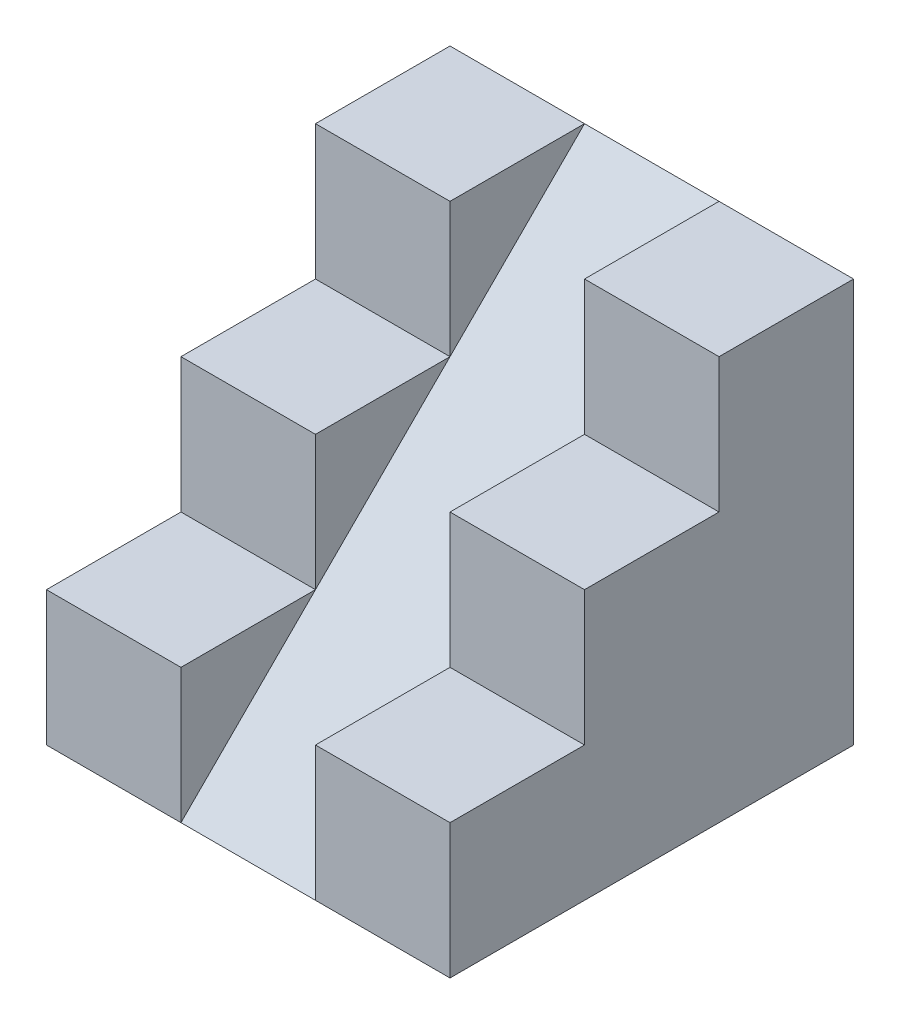
from build123d import *

# Parameters (mm, degrees)
CROQUIS1_W                = 20
CROQUIS1_H                = 60
SALIENTE_EXTRUIR1_DEPTH   = 20
SALIENTE_EXTRUIR1_2_DEPTH = 20
CROQUIS2_W                = 20
CROQUIS2_H                = 40
SALIENTE_EXTRUIR2_DEPTH   = 20
CROQUIS3_W                = 20
CROQUIS3_H                = 20
SALIENTE_EXTRUIR3_DEPTH   = 20
CROQUIS4_W                = 20
CROQUIS4_H                = 60
SALIENTE_EXTRUIR9_DEPTH   = 60
CHAFL_N1_SIZE             = 60


with BuildPart() as part:
    # Croquis1 → Saliente-Extruir1 (new body)
    with BuildSketch(Plane(origin=(0, 0, 0), x_dir=(1, 0, 0), z_dir=(0, 1, 0))):
        with Locations((20, 0)):
            Rectangle(CROQUIS1_W, CROQUIS1_H)
    extrude(amount=SALIENTE_EXTRUIR1_DEPTH)



with BuildPart() as body_2:
    # Croquis1 → Saliente-Extruir1 2 (new body)
    with BuildSketch(Plane(origin=(0, 0, 0), x_dir=(1, 0, 0), z_dir=(0, 1, 0))):
        with Locations((-20, 0)):
            Rectangle(CROQUIS1_W, CROQUIS1_H)
    extrude(amount=SALIENTE_EXTRUIR1_2_DEPTH)


with BuildPart() as part_1:
    add(part.part)

    add(body_2.part)  # Saliente-Extruir2 merges body 2
    # Croquis2 → Saliente-Extruir2 (add)
    with BuildSketch(Plane(origin=(0, 20, 0), x_dir=(1, 0, 0), z_dir=(0, 1, 0))):
        with Locations((20, 10)):
            Rectangle(CROQUIS2_W, CROQUIS2_H)
        with Locations((-20, 10)):
            Rectangle(CROQUIS2_W, CROQUIS2_H)
    extrude(amount=SALIENTE_EXTRUIR2_DEPTH)

    # Croquis3 → Saliente-Extruir3 (add)
    with BuildSketch(Plane(origin=(0, 40, 0), x_dir=(1, 0, 0), z_dir=(0, 1, 0))):
        with Locations((20, 20)):
            Rectangle(CROQUIS3_W, CROQUIS3_H)
        with Locations((-20, 20)):
            Rectangle(CROQUIS3_W, CROQUIS3_H)
    extrude(amount=SALIENTE_EXTRUIR3_DEPTH)


with BuildPart() as body_2_2:
    # Croquis4 → Saliente-Extruir9 (new body)
    with BuildSketch(Plane(origin=(0, 60, 0), x_dir=(1, 0, 0), z_dir=(0, 1, 0))):
        Rectangle(CROQUIS4_W, CROQUIS4_H)
    extrude(amount=-SALIENTE_EXTRUIR9_DEPTH)

    # Chaflán1
    chafl_n1_edges = [body_2_2.edges().sort_by_distance(p)[0] for p in [
        (0, 60, 30),
    ]]
    chamfer(chafl_n1_edges, length=CHAFL_N1_SIZE - 0.0001)  # a hair under: the kernel refuses the full size


solid = Compound([part_1.part, body_2_2.part])
